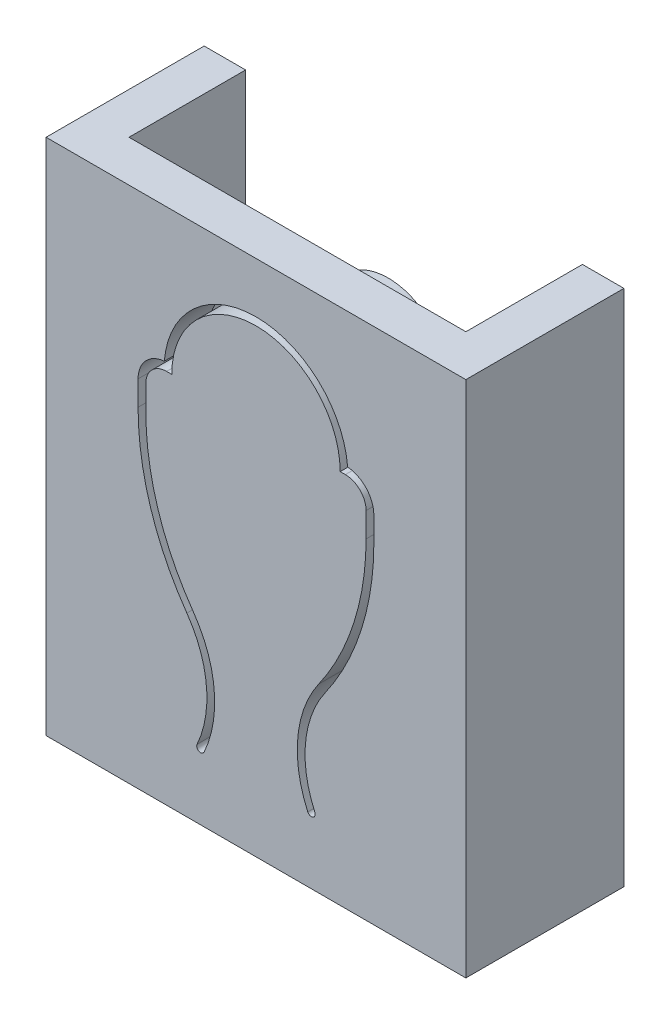
from build123d import *

# Parameters (mm, degrees)
CUT_EXTRUDE1_DEPTH     = 5
CUT_EXTRUDE3_DEPTH     = 45
SKETCH8_R              = 40
CUT_EXTRUDE4_DEPTH     = 32
FILLET1_R              = 7
FILLET2_R              = 8
CUT_REVOLVE1_START     = 17
CUT_REVOLVE1_DEPTH     = 30.5
SKETCH18_W             = 13
SKETCH18_H             = 8
CUT_EXTRUDE13_DEPTH    = 5
SKETCH20_W             = 84
SKETCH20_H             = 7
CUT_EXTRUDE15_DEPTH    = 5
SKETCH19_R             = 1.5
CUT_EXTRUDE14_DEPTH    = 12
FILLET3_R              = 4
SKETCH21_W             = 16
SKETCH21_H             = 5
CUT_EXTRUDE16_DEPTH    = 5
CIRPATTERN1_COUNT      = 4
SKETCH22_W             = 5
SKETCH22_H             = 12
BOSS_EXTRUDE1_DEPTH    = 1.5
SKETCH23_W             = 5
SKETCH23_H             = 4.4
SKETCH23_H_2           = 4
BOSS_EXTRUDE2_DEPTH    = 17
SKETCH24_W             = 2
SKETCH24_H             = 3
BOSS_EXTRUDE3_DEPTH    = 2
CIRPATTERN2_COUNT      = 5
CUT_REVOLVE2_START     = 17
CUT_REVOLVE2_DEPTH     = 30.5
SKETCH29_W             = 16.2
SKETCH29_H             = 11.2
SKETCH29_W_2           = 13
SKETCH29_H_2           = 8
BOSS_EXTRUDE4_DEPTH    = 20
CUT_EXTRUDE18_DEPTH    = 12
SKETCH34_R             = 2.3
BOSS_EXTRUDE5_DEPTH    = 3.5
BOSS_EXTRUDE6_START    = 3.5
SKETCH35_R             = 2.3
BOSS_EXTRUDE6_DEPTH    = 3.5
SKETCH36_W             = 2
SKETCH36_H             = 2
BOSS_EXTRUDE7_DEPTH    = 5
SKETCH37_W             = 2
SKETCH37_H             = 2
BOSS_EXTRUDE8_DEPTH    = 12.5
SKETCH40_W             = 2
SKETCH40_H             = 2
BOSS_EXTRUDE9_DEPTH    = 5
INTERSECT5_OUTLINE_R   = 42
INTERSECT5_DEPTH       = 55
INTERSECT5_2_OUTLINE_W = 16
INTERSECT5_2_OUTLINE_H = 5
INTERSECT5_2_DEPTH     = 15.5
INTERSECT5_START       = 47.5
INTERSECT5_3_OUTLINE_W = 13
INTERSECT5_3_OUTLINE_H = 8
INTERSECT5_3_DEPTH     = 2.5
INTERSECT6_START       = -35.6
INTERSECT6_OUTLINE_W   = 16.2
INTERSECT6_OUTLINE_H   = 20
INTERSECT6_DEPTH       = 5.1
SKETCH46_R             = 2.3
CUT_EXTRUDE20_DEPTH    = 0.5


# Read off the part's stored shape, not the designer's step: Cut-Revolve1, Cut-Revolve2, Intersect5, Intersect6
with BuildPart() as part:
    # Sketch1 → Revolve1 (revolve)
    with BuildSketch(Plane.XY, mode=Mode.PRIVATE) as revolve1_sk:
        with BuildLine():
            Line((37, 55), (0, 55))
            Line((0, 55), (0, 11.5))
            Line((0, 11.5), (22.5, 11.5))
            Line((22.5, 11.5), (22.5, 0))
            Line((22.5, 0), (25, 0))
            Line((25, 0), (25, 11.5))
            Line((25, 11.5), (42, 11.5))
            Line((42, 11.5), (42, 50))
            ThreePointArc((42, 50), (40.535533906, 53.535533906), (37, 55))
        make_face()
    revolve(revolve1_sk.sketch.rotate(Axis((0, 2, 0), (0, 1, 0)), 90), axis=Axis((0, 2, 0), (0, 1, 0)))

    # Sketch5 → Cut-Extrude1 (cut)
    with BuildSketch(Plane(origin=(0, 55, 0), x_dir=(1, 0, 0), z_dir=(0, 1, 0))):
        with BuildLine():
            Line((-42, 0), (-40, 0))
            Line((-40, 0), (40, 0))
            Line((40, 0), (42, 0))
            ThreePointArc((42, 0), (0, 42), (-42, 0))
        make_face()
    extrude(amount=-CUT_EXTRUDE1_DEPTH, mode=Mode.SUBTRACT)

    # Sketch7 → Cut-Extrude3 (cut)
    with BuildSketch(Plane.XZ.offset(-11.5)):
        with BuildLine():
            Line((-21, 0), (21, 0))
            ThreePointArc((21, 0), (0, -21), (-21, 0))
        make_face()
    extrude(amount=-CUT_EXTRUDE3_DEPTH, mode=Mode.SUBTRACT)

    # Sketch8 → Cut-Extrude4 (cut)
    with BuildSketch(Plane(origin=(0, 47.5, 0), x_dir=(1, 0, 0), z_dir=(0, 1, 0))):
        with Locations(Location((0, 0, 0), (0, 0, 270))):
            Circle(SKETCH8_R)
        with BuildLine():
            Line((22.912878475, -2), (-22.912878475, -2))
            ThreePointArc((-22.912878475, -2), (0, 23), (22.912878475, -2))
        make_face(mode=Mode.SUBTRACT)
    extrude(amount=-CUT_EXTRUDE4_DEPTH, mode=Mode.SUBTRACT)

    # Fillet1
    fillet1_edges = [part.edges().sort_by_distance(p)[0] for p in [
        (21, 30.75, 0),
        (-21, 30.75, 0),
    ]]
    fillet(fillet1_edges, radius=FILLET1_R)

    # Fillet2
    fillet2_edges = [part.edges().sort_by_distance(p)[0] for p in [
        (-22.912878475, 31.5, 2),
        (22.912878475, 31.5, 2),
    ]]
    fillet(fillet2_edges, radius=FILLET2_R)

    # Cut-Revolve1 outline → Cut-Revolve1 (cut)
    with BuildSketch(Plane(origin=(0, 0, 0), x_dir=(1, 0, 0), z_dir=(0, 1, 0)).offset(CUT_REVOLVE1_START)):
        with BuildLine():
            Line((-34.641016151, -20), (-36.373066959, -21))
            ThreePointArc((-36.373066959, -21), (0, -42), (36.373066959, -21))
            Line((36.373066959, -21), (34.641016151, -20))
            ThreePointArc((34.641016151, -20), (0, -40), (-34.641016151, -20))
        make_face()
    extrude(amount=CUT_REVOLVE1_DEPTH, mode=Mode.SUBTRACT)

    # Sketch18 → Cut-Extrude13 (cut)
    with BuildSketch(Plane(origin=(0, 50, 0), x_dir=(1, 0, 0), z_dir=(0, 1, 0))):
        with Locations((0, 30)):
            Rectangle(SKETCH18_W, SKETCH18_H)
    extrude(amount=-CUT_EXTRUDE13_DEPTH, mode=Mode.SUBTRACT)

    # Sketch20 → Cut-Extrude15 (cut)
    with BuildSketch(Plane(origin=(0, 55, 0), x_dir=(1, 0, 0), z_dir=(0, 1, 0))):
        with Locations((0, -3.5)):
            Rectangle(SKETCH20_W, SKETCH20_H)
    extrude(amount=-CUT_EXTRUDE15_DEPTH, mode=Mode.SUBTRACT)

    # Sketch19 → Cut-Extrude14 (cut)
    with BuildSketch(Plane(origin=(0, 0, 7), x_dir=(-1, 0, 0), z_dir=(0, 0, -1))):
        with Locations((0, 52.5)):
            Circle(SKETCH19_R)
        with Locations((-29.412558482, 52.5)):
            Circle(SKETCH19_R)
        with Locations((29.412558482, 52.5)):
            Circle(SKETCH19_R)
    extrude(amount=-CUT_EXTRUDE14_DEPTH, mode=Mode.SUBTRACT)

    # Fillet3
    fillet3_edges = [part.edges().sort_by_distance(p)[0] for p in [
        (0, 11.5, 42),
    ]]
    fillet(fillet3_edges, radius=FILLET3_R)

    # Sketch21 → Cut-Extrude16 (cut)
    with BuildSketch(Plane(origin=(0, 15.5, 0), x_dir=(1, 0, 0), z_dir=(0, 1, 0))):
        with Locations((0, -29.5)):
            Rectangle(SKETCH21_W, SKETCH21_H)
    cut_extrude16 = extrude(amount=-CUT_EXTRUDE16_DEPTH, mode=Mode.SUBTRACT)

    # CirPattern1: Cut-Extrude16 ×4 about axis
    cirpattern1_axis = Axis((0, 0, 0), (0, 1, 0))
    for i in range(1, CIRPATTERN1_COUNT):
        add(cut_extrude16.rotate(cirpattern1_axis, i * 360 / CIRPATTERN1_COUNT), mode=Mode.SUBTRACT)

    # Sketch22 → Boss-Extrude1 (add)
    with BuildSketch(Plane(origin=(0, 15.5, 0), x_dir=(1, 0, 0), z_dir=(0, 1, 0))):
        with Locations((35.5, -4)):
            Rectangle(SKETCH22_W, SKETCH22_H)
    extrude(amount=BOSS_EXTRUDE1_DEPTH)

    # Sketch23 → Boss-Extrude2 (add)
    with BuildSketch(Plane(origin=(0, 17, 0), x_dir=(1, 0, 0), z_dir=(0, 1, 0))):
        with Locations((35.5, -0.2)):
            Rectangle(SKETCH23_W, SKETCH23_H)
        with Locations((35.5, -8)):
            Rectangle(SKETCH23_W, SKETCH23_H_2)
    extrude(amount=BOSS_EXTRUDE2_DEPTH)

    # Sketch24 → Boss-Extrude3 (add)
    with BuildSketch(Plane.XZ):
        with Locations((0, -22.5)):
            Rectangle(SKETCH24_W, SKETCH24_H)
    boss_extrude3 = extrude(amount=-BOSS_EXTRUDE3_DEPTH)

    # CirPattern2: Boss-Extrude3 ×5 about axis
    cirpattern2_axis = Axis((0, 0, 0), (0, 1, 0))
    for i in range(1, CIRPATTERN2_COUNT):
        add(boss_extrude3.rotate(cirpattern2_axis, i * 360 / CIRPATTERN2_COUNT))

    # Cut-Revolve2 outline → Cut-Revolve2 (cut)
    with BuildSketch(Plane(origin=(0, 0, 0), x_dir=(1, 0, 0), z_dir=(0, 1, 0)).offset(CUT_REVOLVE2_START)):
        with BuildLine():
            ThreePointArc((-30.641777725, 25.711504387), (0, 40), (30.641777725, 25.711504387))
            Line((30.641777725, 25.711504387), (32.173866611, 26.997079607))
            ThreePointArc((32.173866611, 26.997079607), (0, 42), (-32.173866611, 26.997079607))
            Line((-32.173866611, 26.997079607), (-30.641777725, 25.711504387))
        make_face()
    extrude(amount=CUT_REVOLVE2_DEPTH, mode=Mode.SUBTRACT)

    # Sketch29 → Boss-Extrude4 (add)
    with BuildSketch(Plane.XZ.offset(-47.5)):
        with Locations((0, -30)):
            Rectangle(SKETCH29_W, SKETCH29_H)
        with Locations((0, -30)):
            Rectangle(SKETCH29_W_2, SKETCH29_H_2, mode=Mode.SUBTRACT)
    extrude(amount=BOSS_EXTRUDE4_DEPTH)

    # Sketch32 → Cut-Extrude18 (cut)
    with BuildSketch(Plane(origin=(0, 0, -35.6), x_dir=(-1, 0, 0), z_dir=(0, 0, -1))):
        with BuildLine():
            Line((-4.55, 40.24987133), (-4.55, 41.2))
            ThreePointArc((-4.55, 41.2), (-4.258194078, 41.946205288), (-3.537595761, 42.296506718))
            ThreePointArc((-3.537595761, 42.296506718), (0, 45.55), (3.537595761, 42.296506718))
            ThreePointArc((3.537595761, 42.296506718), (4.258194078, 41.946205288), (4.55, 41.2))
            Line((4.55, 41.2), (4.55, 40.24987133))
            ThreePointArc((4.55, 40.24987133), (4.068040722, 37.136018992), (2.667266721, 34.313574426))
            ThreePointArc((2.667266721, 34.313574426), (1.91246078, 32.271330642), (2.273109943, 30.124140883))
            ThreePointArc((2.273109943, 30.124140883), (2.198625413, 29.92551547), (2, 30))
            ThreePointArc((2, 30), (1.613779787, 32.29943161), (2.422103613, 34.486476277))
            ThreePointArc((2.422103613, 34.486476277), (3.782078371, 37.22671372), (4.25, 40.24987133))
            Line((4.25, 40.24987133), (4.25, 41.2))
            ThreePointArc((4.25, 41.2), (4.015685425, 41.765685425), (3.45, 42))
            Line((3.45, 42), (3.25, 42))
            ThreePointArc((3.25, 42), (0, 45.25), (-3.25, 42))
            Line((-3.25, 42), (-3.45, 42))
            ThreePointArc((-3.45, 42), (-4.015685425, 41.765685425), (-4.25, 41.2))
            Line((-4.25, 41.2), (-4.25, 40.24987133))
            ThreePointArc((-4.25, 40.24987133), (-3.782078371, 37.22671372), (-2.422103613, 34.486476277))
            ThreePointArc((-2.422103613, 34.486476277), (-1.613779787, 32.29943161), (-2, 30))
            ThreePointArc((-2, 30), (-2.198625413, 29.92551547), (-2.273109943, 30.124140883))
            ThreePointArc((-2.273109943, 30.124140883), (-1.91246078, 32.271330642), (-2.667266721, 34.313574426))
            ThreePointArc((-2.667266721, 34.313574426), (-4.068040722, 37.136018992), (-4.55, 40.24987133))
        make_face()
    extrude(amount=-CUT_EXTRUDE18_DEPTH, mode=Mode.SUBTRACT)

    # Sketch34 → Boss-Extrude5 (add)
    with BuildSketch(Plane.XY.offset(-34)):
        with Locations(Location((0, 42, 0), (0, 0, 180))):
            Circle(SKETCH34_R)
    extrude(amount=BOSS_EXTRUDE5_DEPTH)

    # Sketch35 → Boss-Extrude6 (add)
    with BuildSketch(Plane(origin=(0, 0, -26), x_dir=(-1, 0, 0), z_dir=(0, 0, -1)).offset(BOSS_EXTRUDE6_START)):
        with Locations((0, 42)):
            Circle(SKETCH35_R)
    extrude(amount=-BOSS_EXTRUDE6_DEPTH)

    # Sketch36 → Boss-Extrude7 (add)
    with BuildSketch(Plane(origin=(0, 0, -35.6), x_dir=(-1, 0, 0), z_dir=(0, 0, -1))):
        with Locations((-6.159647943, 37.918102195)):
            Rectangle(SKETCH36_W, SKETCH36_H)
    extrude(amount=BOSS_EXTRUDE7_DEPTH)

    # Sketch37 → Boss-Extrude8 (add)
    with BuildSketch(Plane.ZY.offset(-5.159647943)):
        with Locations((-39.597351245, 37.918102195)):
            Rectangle(SKETCH37_W, SKETCH37_H)
    extrude(amount=BOSS_EXTRUDE8_DEPTH)

    # Sketch40 → Boss-Extrude9 (add)
    with BuildSketch(Plane(origin=(0, 0, -35.6), x_dir=(-1, 0, 0), z_dir=(0, 0, -1))):
        with Locations((6.340352057, 37.918102195)):
            Rectangle(SKETCH40_W, SKETCH40_H)
    extrude(amount=BOSS_EXTRUDE9_DEPTH)

    # Intersect5 outline → Intersect5 (cut)
    with BuildSketch(Plane(origin=(0, 0, 0), x_dir=(1, 0, 0), z_dir=(0, 1, 0))):
        Circle(INTERSECT5_OUTLINE_R)
        with BuildLine():
            Line((-7.340352057, 39.320722675), (-7.340352057, 35.6))
            Line((-7.340352057, 35.6), (7.159647943, 35.6))
            Line((7.159647943, 35.6), (7.159647943, 39.354027003))
            ThreePointArc((7.159647943, 39.354027003), (32.84390905, 22.831505389), (39.382737335, -7))
            Line((39.382737335, -7), (38, -7))
            Line((38, -7), (38, 2))
            Line((38, 2), (33, 2))
            Line((33, 2), (33, -7))
            Line((33, -7), (32, -7))
            Line((32, -7), (32, 8))
            Line((32, 8), (27, 8))
            Line((27, 8), (27, -7))
            Line((27, -7), (21.38340478, -7))
            ThreePointArc((21.38340478, -7), (22.491014191, -0.635830699), (21.744722088, 5.780749199))
            ThreePointArc((21.744722088, 5.780749199), (21.600641781, 7.527000579), (21.079848197, 9.2))
            ThreePointArc((21.079848197, 9.2), (0, 23), (-21.079848197, 9.2))
            ThreePointArc((-21.079848197, 9.2), (-21.600641781, 7.527000579), (-21.744722088, 5.780749199))
            ThreePointArc((-21.744722088, 5.780749199), (-22.491014191, -0.635830699), (-21.38340478, -7))
            Line((-21.38340478, -7), (-27, -7))
            Line((-27, -7), (-27, 8))
            Line((-27, 8), (-32, 8))
            Line((-32, 8), (-32, -7))
            Line((-32, -7), (-39.382737335, -7))
            ThreePointArc((-39.382737335, -7), (-32.896262825, 22.756007825), (-7.340352057, 39.320722675))
        make_face(mode=Mode.SUBTRACT)
        with BuildLine():
            Line((12.124355653, 0), (-12.124355653, 0))
            ThreePointArc((-12.124355653, 0), (-18.186533479, 3.5), (-18.186533479, 10.5))
            ThreePointArc((-18.186533479, 10.5), (0, 21), (18.186533479, 10.5))
            ThreePointArc((18.186533479, 10.5), (18.186533479, 3.5), (12.124355653, 0))
        make_face(mode=Mode.SUBTRACT)
    extrude(amount=INTERSECT5_DEPTH, mode=Mode.SUBTRACT)

    # Intersect5 2 outline → Intersect5 2 (cut)
    with BuildSketch(Plane(origin=(0, 0, 0), x_dir=(1, 0, 0), z_dir=(0, 1, 0))):
        with BuildLine():
            Line((-7.340352057, 35.6), (-7.340352057, 39.320722675))
            ThreePointArc((-7.340352057, 39.320722675), (-32.896262825, 22.756007825), (-39.382737335, -7))
            Line((-39.382737335, -7), (-32, -7))
            Line((-32, -7), (-32, 8))
            Line((-32, 8), (-27, 8))
            Line((-27, 8), (-27, -7))
            Line((-27, -7), (-21.38340478, -7))
            ThreePointArc((-21.38340478, -7), (-22.491014191, -0.635830699), (-21.744722088, 5.780749199))
            ThreePointArc((-21.744722088, 5.780749199), (-21.600641781, 7.527000579), (-21.079848197, 9.2))
            ThreePointArc((-21.079848197, 9.2), (0, 23), (21.079848197, 9.2))
            ThreePointArc((21.079848197, 9.2), (21.600641781, 7.527000579), (21.744722088, 5.780749199))
            ThreePointArc((21.744722088, 5.780749199), (22.491014191, -0.635830699), (21.38340478, -7))
            Line((21.38340478, -7), (27, -7))
            Line((27, -7), (27, 8))
            Line((27, 8), (32, 8))
            Line((32, 8), (32, -7))
            Line((32, -7), (33, -7))
            Line((33, -7), (33, 2))
            Line((33, 2), (38, 2))
            Line((38, 2), (38, -7))
            Line((38, -7), (39.382737335, -7))
            ThreePointArc((39.382737335, -7), (32.84390905, 22.831505389), (7.159647943, 39.354027003))
            Line((7.159647943, 39.354027003), (7.159647943, 35.6))
            Line((7.159647943, 35.6), (-7.340352057, 35.6))
        make_face()
        with Locations((0, 29.5)):
            Rectangle(INTERSECT5_2_OUTLINE_W, INTERSECT5_2_OUTLINE_H, mode=Mode.SUBTRACT)
    extrude(amount=INTERSECT5_2_DEPTH, mode=Mode.SUBTRACT)

    # Intersect5 3 outline → Intersect5 3 (cut)
    with BuildSketch(Plane(origin=(0, 0, 0), x_dir=(1, 0, 0), z_dir=(0, 1, 0)).offset(INTERSECT5_START)):
        with BuildLine():
            Line((-7.340352057, 35.6), (-7.340352057, 39.320722675))
            ThreePointArc((-7.340352057, 39.320722675), (-32.896262825, 22.756007825), (-39.382737335, -7))
            Line((-39.382737335, -7), (-32, -7))
            Line((-32, -7), (-32, 8))
            Line((-32, 8), (-27, 8))
            Line((-27, 8), (-27, -7))
            Line((-27, -7), (-21.38340478, -7))
            ThreePointArc((-21.38340478, -7), (-22.491014191, -0.635830699), (-21.744722088, 5.780749199))
            ThreePointArc((-21.744722088, 5.780749199), (-21.600641781, 7.527000579), (-21.079848197, 9.2))
            ThreePointArc((-21.079848197, 9.2), (0, 23), (21.079848197, 9.2))
            ThreePointArc((21.079848197, 9.2), (21.600641781, 7.527000579), (21.744722088, 5.780749199))
            ThreePointArc((21.744722088, 5.780749199), (22.491014191, -0.635830699), (21.38340478, -7))
            Line((21.38340478, -7), (27, -7))
            Line((27, -7), (27, 8))
            Line((27, 8), (32, 8))
            Line((32, 8), (32, -7))
            Line((32, -7), (33, -7))
            Line((33, -7), (33, 2))
            Line((33, 2), (38, 2))
            Line((38, 2), (38, -7))
            Line((38, -7), (39.382737335, -7))
            ThreePointArc((39.382737335, -7), (32.84390905, 22.831505389), (7.159647943, 39.354027003))
            Line((7.159647943, 39.354027003), (7.159647943, 35.6))
            Line((7.159647943, 35.6), (-7.340352057, 35.6))
        make_face()
        with Locations((0, 30)):
            Rectangle(INTERSECT5_3_OUTLINE_W, INTERSECT5_3_OUTLINE_H, mode=Mode.SUBTRACT)
    extrude(amount=INTERSECT5_3_DEPTH, mode=Mode.SUBTRACT)

    # Intersect6 outline → Intersect6 (cut)
    with BuildSketch(Plane.XY.offset(INTERSECT6_START)):
        with Locations((0, 37.5)):
            Rectangle(INTERSECT6_OUTLINE_W, INTERSECT6_OUTLINE_H)
        with BuildLine():
            ThreePointArc((4.25, 41.2), (4.015685425, 41.765685425), (3.45, 42))
            Line((3.45, 42), (3.25, 42))
            ThreePointArc((3.25, 42), (0, 45.25), (-3.25, 42))
            Line((-3.25, 42), (-3.45, 42))
            ThreePointArc((-3.45, 42), (-4.015685425, 41.765685425), (-4.25, 41.2))
            Line((-4.25, 41.2), (-4.25, 40.24987133))
            ThreePointArc((-4.25, 40.24987133), (-3.782078371, 37.22671372), (-2.422103613, 34.486476277))
            ThreePointArc((-2.422103613, 34.486476277), (-1.613779787, 32.29943161), (-2, 30))
            ThreePointArc((-2, 30), (-2.198625413, 29.92551547), (-2.273109943, 30.124140883))
            ThreePointArc((-2.273109943, 30.124140883), (-1.91246078, 32.271330642), (-2.667266721, 34.313574426))
            ThreePointArc((-2.667266721, 34.313574426), (-4.068040722, 37.136018992), (-4.55, 40.24987133))
            Line((-4.55, 40.24987133), (-4.55, 41.2))
            ThreePointArc((-4.55, 41.2), (-4.258194078, 41.946205288), (-3.537595761, 42.296506718))
            ThreePointArc((-3.537595761, 42.296506718), (0, 45.55), (3.537595761, 42.296506718))
            ThreePointArc((3.537595761, 42.296506718), (4.258194078, 41.946205288), (4.55, 41.2))
            Line((4.55, 41.2), (4.55, 40.24987133))
            ThreePointArc((4.55, 40.24987133), (4.068040722, 37.136018992), (2.667266721, 34.313574426))
            ThreePointArc((2.667266721, 34.313574426), (1.91246078, 32.271330642), (2.273109943, 30.124140883))
            ThreePointArc((2.273109943, 30.124140883), (2.198625413, 29.92551547), (2, 30))
            ThreePointArc((2, 30), (1.613779787, 32.29943161), (2.422103613, 34.486476277))
            ThreePointArc((2.422103613, 34.486476277), (3.782078371, 37.22671372), (4.25, 40.24987133))
            Line((4.25, 40.24987133), (4.25, 41.2))
        make_face(mode=Mode.SUBTRACT)
    extrude(amount=INTERSECT6_DEPTH, mode=Mode.SUBTRACT)

    # Sketch46 → Cut-Extrude20 (cut)
    with BuildSketch(Plane(origin=(0, 0, -26), x_dir=(-1, 0, 0), z_dir=(0, 0, -1))):
        with BuildLine():
            Line((-3.25, 28.417174007), (3.25, 28.594756863))
            Line((3.25, 28.594756863), (2.273109943, 30.124140883))
            ThreePointArc((2.273109943, 30.124140883), (2.198625413, 29.92551547), (2, 30))
            ThreePointArc((2, 30), (1.613779787, 32.29943161), (2.422103613, 34.486476277))
            ThreePointArc((2.422103613, 34.486476277), (3.782078371, 37.22671372), (4.25, 40.24987133))
            Line((4.25, 40.24987133), (4.25, 41.2))
            ThreePointArc((4.25, 41.2), (4.015685425, 41.765685425), (3.45, 42))
            Line((3.45, 42), (3.25, 42))
            ThreePointArc((3.25, 42), (0, 45.25), (-3.25, 42))
            Line((-3.25, 42), (-3.45, 42))
            ThreePointArc((-3.45, 42), (-4.015685425, 41.765685425), (-4.25, 41.2))
            Line((-4.25, 41.2), (-4.25, 40.24987133))
            ThreePointArc((-4.25, 40.24987133), (-3.782078371, 37.22671372), (-2.422103613, 34.486476277))
            ThreePointArc((-2.422103613, 34.486476277), (-1.613779787, 32.29943161), (-2, 30))
            ThreePointArc((-2, 30), (-2.198625413, 29.92551547), (-2.273109943, 30.124140883))
            Line((-2.273109943, 30.124140883), (-3.25, 28.417174007))
        make_face()
        with Locations((0, 42)):
            Circle(SKETCH46_R, mode=Mode.SUBTRACT)
    extrude(amount=-CUT_EXTRUDE20_DEPTH, mode=Mode.SUBTRACT)


solid = part.part
